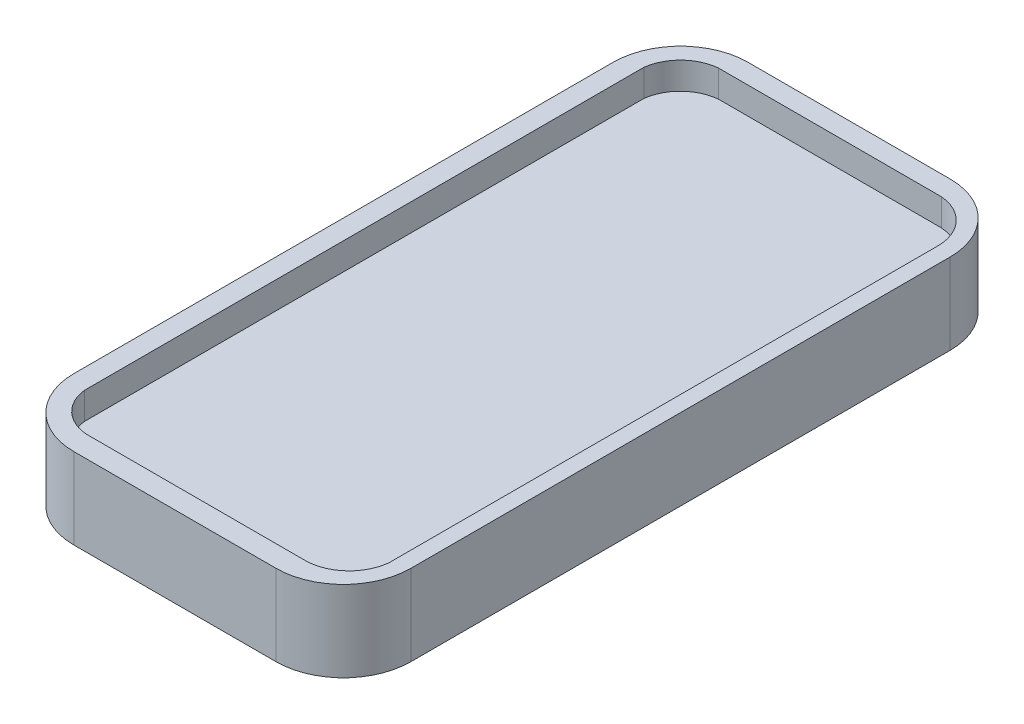
from build123d import *

# Parameters (mm, degrees)
CROQUIS2_W              = 500
CROQUIS2_H              = 1000
SALIENTE_EXTRUIR1_DEPTH = 120
REDONDEO3_R             = 100
CORTAR_EXTRUIR3_DEPTH   = 40


with BuildPart() as part:
    # Croquis2 → Saliente-Extruir1 (new body)
    with BuildSketch(Plane(origin=(0, 0, 0), x_dir=(1, 0, 0), z_dir=(0, 1, 0))):
        with Locations((242.219540343, 451.577872827)):
            Rectangle(CROQUIS2_W, CROQUIS2_H)
    extrude(amount=SALIENTE_EXTRUIR1_DEPTH)

    # Redondeo3
    redondeo3_edges = [part.edges().sort_by_distance(p)[0] for p in [
        (-7.780459657, 60, -951.577872827),
        (492.219540343, 60, -951.577872827),
        (-7.780459657, 60, 48.422127173),
        (492.219540343, 60, 48.422127173),
    ]]
    fillet(redondeo3_edges, radius=REDONDEO3_R)

    # Croquis6 → Cortar-Extruir3 (cut)
    with BuildSketch(Plane(origin=(0, 120, 0), x_dir=(1, 0, 0), z_dir=(0, 1, 0))):
        with BuildLine():
            Line((77.752240524, 922.288550945), (408.615788101, 922.288550945))
            ThreePointArc((408.615788101, 922.288550945), (451.385829489, 901.312824814), (468.879013747, 857.004292547))
            Line((468.879013747, 857.004292547), (468.879013747, 42.218165752))
            ThreePointArc((468.879013747, 42.218165752), (448.612113313, 1.380200922), (406.780484602, -16.747166896))
            Line((406.780484602, -16.747166896), (79.587544024, -16.747166896))
            ThreePointArc((79.587544024, -16.747166896), (40.695958229, 0.077623427), (21.508862224, 37.859687451))
            Line((21.508862224, 37.859687451), (21.508862224, 867.822814394))
            ThreePointArc((21.508862224, 867.822814394), (40.030080371, 904.969491914), (77.752240524, 922.288550945))
        make_face()
    extrude(amount=-CORTAR_EXTRUIR3_DEPTH, mode=Mode.SUBTRACT)


solid = part.part
